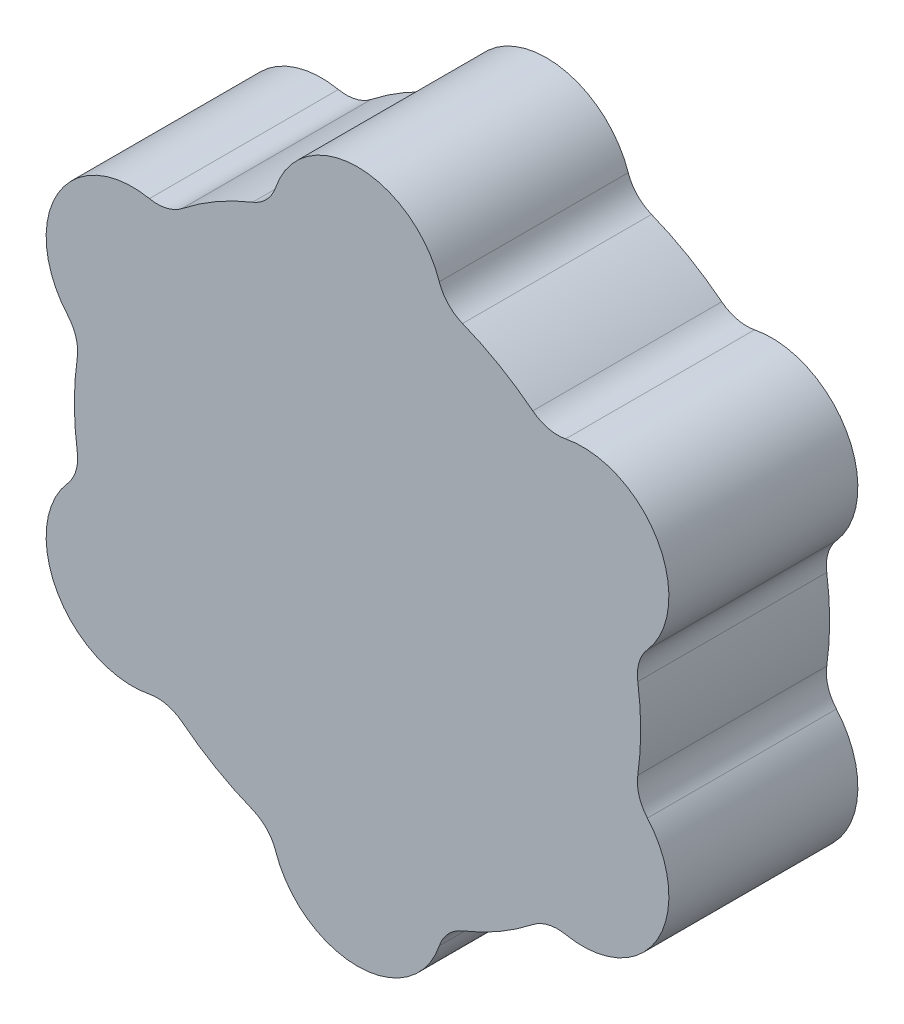
from build123d import *

# Parameters (mm, degrees)
BOSS_EXTRUDE2_DEPTH = 9.525
FILLET1_R           = 2.032


with BuildPart() as part:
    # Sketch5 → Boss-Extrude2 (new body)
    with BuildSketch(Plane.XY):
        with BuildLine():
            ThreePointArc((13.943369395, -3.058163658), (14.2748, 0), (13.943369395, 3.058163658))
            ThreePointArc((13.943369395, 3.058163658), (15.111970091, 8.7249), (9.620132114, 10.546230281))
            ThreePointArc((9.620132114, 10.546230281), (7.1374, 12.362339434), (4.32323728, 13.604393939))
            ThreePointArc((4.32323728, 13.604393939), (0, 17.4498), (-4.32323728, 13.604393939))
            ThreePointArc((-4.32323728, 13.604393939), (-7.1374, 12.362339434), (-9.620132114, 10.546230281))
            ThreePointArc((-9.620132114, 10.546230281), (-15.111970091, 8.7249), (-13.943369395, 3.058163658))
            ThreePointArc((-13.943369395, 3.058163658), (-14.2748, 0), (-13.943369395, -3.058163658))
            ThreePointArc((-13.943369395, -3.058163658), (-15.111970091, -8.7249), (-9.620132114, -10.546230281))
            ThreePointArc((-9.620132114, -10.546230281), (-7.1374, -12.362339434), (-4.32323728, -13.604393939))
            ThreePointArc((-4.32323728, -13.604393939), (0, -17.4498), (4.32323728, -13.604393939))
            ThreePointArc((4.32323728, -13.604393939), (7.1374, -12.362339434), (9.620132114, -10.546230281))
            ThreePointArc((9.620132114, -10.546230281), (15.111970091, -8.7249), (13.943369395, -3.058163658))
        make_face()
    extrude(amount=BOSS_EXTRUDE2_DEPTH)

    # Fillet1
    fillet1_edges = [part.edges().sort_by_distance(p)[0] for p in [
        (-9.620132114, 10.546230281, 4.7625),
        (-4.32323728, 13.604393939, 4.7625),
        (4.32323728, 13.604393939, 4.7625),
        (9.620132114, 10.546230281, 4.7625),
        (13.943369395, 3.058163658, 4.7625),
        (13.943369395, -3.058163658, 4.7625),
        (9.620132114, -10.546230281, 4.7625),
        (4.32323728, -13.604393939, 4.7625),
        (-4.32323728, -13.604393939, 4.7625),
        (-9.620132114, -10.546230281, 4.7625),
        (-13.943369395, -3.058163658, 4.7625),
        (-13.943369395, 3.058163658, 4.7625),
    ]]
    fillet(fillet1_edges, radius=FILLET1_R)


solid = part.part
